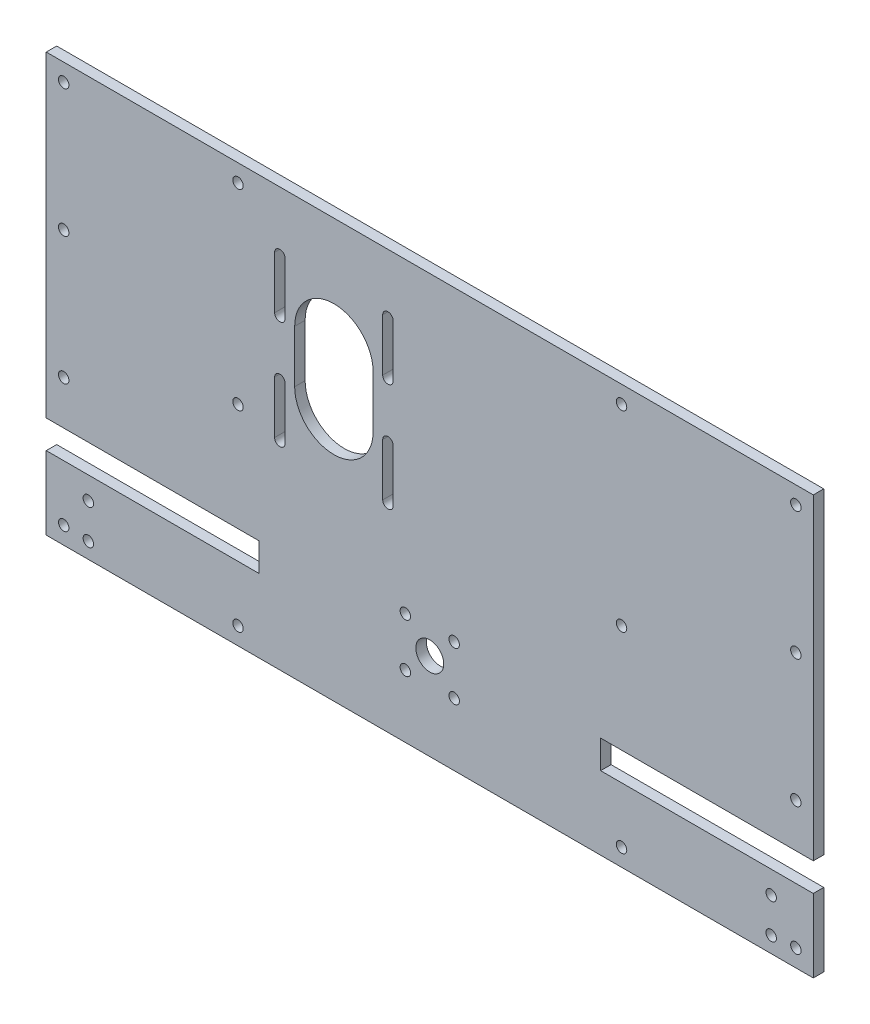
from build123d import *

# Parameters (mm, degrees)
ESQUISSE1_R             = 1.5
BOSS_EXTRU_1_DEPTH      = 3
ESQUISSE2_R             = 1.5
ENL_V_MAT_EXTRU_2_DEPTH = 3
ESQUISSE3_R             = 4
ESQUISSE3_R_2           = 1.5
ENL_V_MAT_EXTRU_3_DEPTH = 10
ESQUISSE4_W             = 100
ESQUISSE4_H             = 21.457187309
ENL_V_MAT_EXTRU_4_DEPTH = 10


with BuildPart() as part:
    # Esquisse1 → Boss.-Extru.1 (new body)
    with BuildSketch(Plane.XY):
        Polygon((-50, -65), (50, -65), (50, -55), (110, -55), (110, -34), (49, -34), (49, -25.9), (110, -25.9), (110, 65), (-110, 65), (-110, -25.9), (-49, -25.9), (-49, -34), (-110, -34), (-110, -55), (-50, -55), align=None)
        with BuildLine():
            ThreePointArc((-41.5, 2), (-43, 0.5), (-44.5, 2))
            Line((-44.5, 2), (-44.5, 17))
            ThreePointArc((-44.5, 17), (-43, 18.5), (-41.5, 17))
            Line((-41.5, 17), (-41.5, 2))
        make_face(mode=Mode.SUBTRACT)
        with BuildLine():
            Line((-10.5, 17), (-10.5, 2))
            ThreePointArc((-10.5, 2), (-12, 0.5), (-13.5, 2))
            Line((-13.5, 2), (-13.5, 17))
            ThreePointArc((-13.5, 17), (-12, 18.5), (-10.5, 17))
        make_face(mode=Mode.SUBTRACT)
        with BuildLine():
            ThreePointArc((-16.25, 17.5), (-27.5, 6.25), (-38.75, 17.5))
            Line((-38.75, 17.5), (-38.75, 32.5))
            ThreePointArc((-38.75, 32.5), (-27.5, 43.75), (-16.25, 32.5))
            Line((-16.25, 32.5), (-16.25, 17.5))
        make_face(mode=Mode.SUBTRACT)
        with BuildLine():
            ThreePointArc((-41.5, 33), (-43, 31.5), (-44.5, 33))
            Line((-44.5, 33), (-44.5, 48))
            ThreePointArc((-44.5, 48), (-43, 49.5), (-41.5, 48))
            Line((-41.5, 48), (-41.5, 33))
        make_face(mode=Mode.SUBTRACT)
        with BuildLine():
            Line((-10.5, 48), (-10.5, 33))
            ThreePointArc((-10.5, 33), (-12, 31.5), (-13.5, 33))
            Line((-13.5, 33), (-13.5, 48))
            ThreePointArc((-13.5, 48), (-12, 49.5), (-10.5, 48))
        make_face(mode=Mode.SUBTRACT)
        with Locations((-97.928308863, -40.455320997)):
            Circle(ESQUISSE1_R, mode=Mode.SUBTRACT)
        with Locations((-105, -50)):
            Circle(ESQUISSE1_R, mode=Mode.SUBTRACT)
        with Locations((-97.928308863, -50.455320997)):
            Circle(ESQUISSE1_R, mode=Mode.SUBTRACT)
        with Locations((-105, 60)):
            Circle(ESQUISSE1_R, mode=Mode.SUBTRACT)
        with Locations((-105, -13.333333333)):
            Circle(ESQUISSE1_R, mode=Mode.SUBTRACT)
        with Locations((-105, 23.333333333)):
            Circle(ESQUISSE1_R, mode=Mode.SUBTRACT)
        with Locations((105, 60)):
            Circle(ESQUISSE1_R, mode=Mode.SUBTRACT)
        with Locations((105, -13.333333333)):
            Circle(ESQUISSE1_R, mode=Mode.SUBTRACT)
        with Locations((105, 23.333333333)):
            Circle(ESQUISSE1_R, mode=Mode.SUBTRACT)
        with Locations((97.928308863, -40.455320997)):
            Circle(ESQUISSE1_R, mode=Mode.SUBTRACT)
        with Locations((97.928308863, -50.455320997)):
            Circle(ESQUISSE1_R, mode=Mode.SUBTRACT)
        with Locations((105, -50)):
            Circle(ESQUISSE1_R, mode=Mode.SUBTRACT)
    extrude(amount=BOSS_EXTRU_1_DEPTH)

    # Esquisse2 → Enlèv. mat.-Extru.2 (cut)
    with BuildSketch(Plane.XY.offset(3)):
        with Locations((45, -60)):
            Circle(ESQUISSE2_R)
        with Locations((-55, -50)):
            Circle(ESQUISSE2_R)
        with Locations((-55, 5)):
            Circle(ESQUISSE2_R)
        with Locations((-55, 60)):
            Circle(ESQUISSE2_R)
        with Locations((22.5, -60)):
            Circle(ESQUISSE2_R)
        with Locations((0, -60)):
            Circle(ESQUISSE2_R)
        with Locations((-22.5, -60)):
            Circle(ESQUISSE2_R)
        with Locations((-45, -60)):
            Circle(ESQUISSE2_R)
        with Locations((55, -50)):
            Circle(ESQUISSE2_R)
        with Locations((55, 5)):
            Circle(ESQUISSE2_R)
        with Locations((55, 60)):
            Circle(ESQUISSE2_R)
    extrude(amount=-ENL_V_MAT_EXTRU_2_DEPTH, mode=Mode.SUBTRACT)

    # Esquisse3 → Enlèv. mat.-Extru.3 (cut)
    with BuildSketch(Plane.XY.offset(3)):
        with Locations((0, -30)):
            Circle(ESQUISSE3_R)
        with Locations((-7, -23)):
            Circle(ESQUISSE3_R_2)
        with Locations((7, -23)):
            Circle(ESQUISSE3_R_2)
        with Locations((7, -37)):
            Circle(ESQUISSE3_R_2)
        with Locations((-7, -37)):
            Circle(ESQUISSE3_R_2)
    extrude(amount=-ENL_V_MAT_EXTRU_3_DEPTH, mode=Mode.SUBTRACT)

    # Esquisse4 → Enlèv. mat.-Extru.4 (cut)
    with BuildSketch(Plane.XY.offset(3)):
        with Locations((0, -65.728593655)):
            Rectangle(ESQUISSE4_W, ESQUISSE4_H)
    extrude(amount=-ENL_V_MAT_EXTRU_4_DEPTH, mode=Mode.SUBTRACT)


solid = part.part
